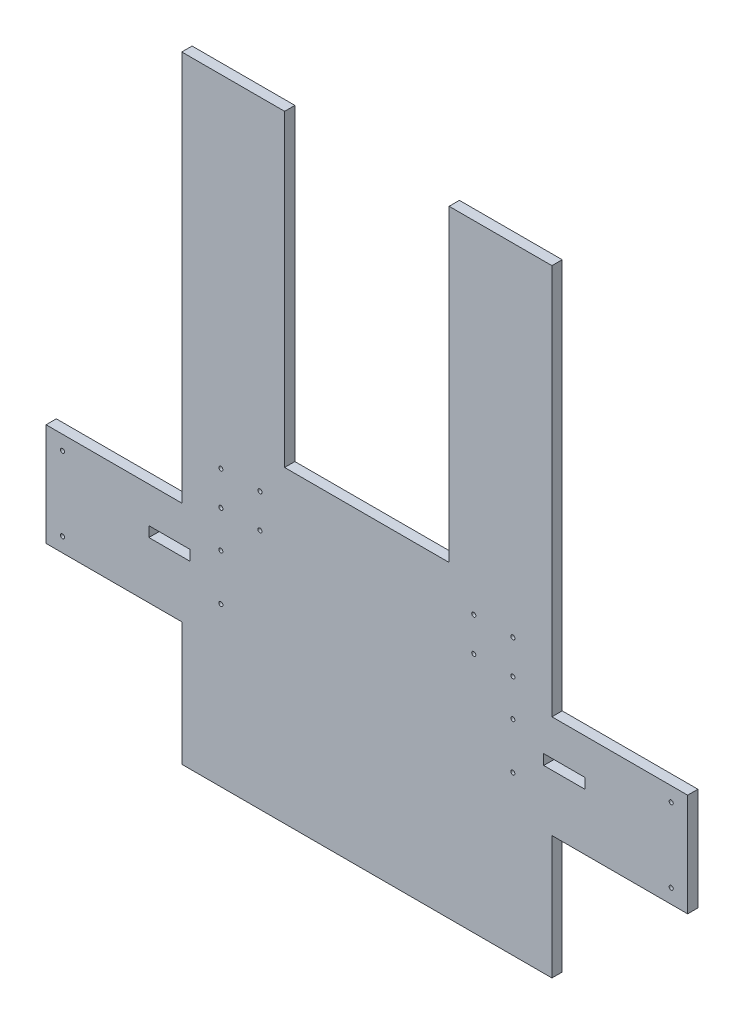
from build123d import *

# Parameters (mm, degrees)
SKETCH1_R           = 1
BOSS_EXTRUDE1_DEPTH = 5
SKETCH2_R           = 1
CUT_EXTRUDE1_DEPTH  = 388.996134001
SKETCH3_R           = 1
SKETCH3_W           = 20
SKETCH3_H           = 5
CUT_EXTRUDE2_DEPTH  = 388.996134001


with BuildPart() as part:
    # Sketch1 → Boss-Extrude1 (new body)
    with BuildSketch(Plane.XY):
        Polygon((0, 60), (0, 0), (180, 0), (180, 60), (246, 60), (246, 110), (180, 110), (180, 300), (130, 300), (130, 150), (50, 150), (50, 300), (0, 300), (0, 110), (-66, 110), (-66, 60), align=None)
        with Locations((19, 117.5)):
            Circle(SKETCH1_R, mode=Mode.SUBTRACT)
        with Locations((38, 117.5)):
            Circle(SKETCH1_R, mode=Mode.SUBTRACT)
        with Locations((19, 134)):
            Circle(SKETCH1_R, mode=Mode.SUBTRACT)
        with Locations((38, 134)):
            Circle(SKETCH1_R, mode=Mode.SUBTRACT)
        with Locations((142, 117.5)):
            Circle(SKETCH1_R, mode=Mode.SUBTRACT)
        with Locations((161, 117.5)):
            Circle(SKETCH1_R, mode=Mode.SUBTRACT)
        with Locations((142, 134)):
            Circle(SKETCH1_R, mode=Mode.SUBTRACT)
        with Locations((161, 134)):
            Circle(SKETCH1_R, mode=Mode.SUBTRACT)
    extrude(amount=BOSS_EXTRUDE1_DEPTH)

    # Sketch2 → Cut-Extrude1 (cut, through all)
    with BuildSketch(Plane.XY.offset(5)):
        with Locations((-58, 103)):
            Circle(SKETCH2_R)
        with Locations((-58, 67)):
            Circle(SKETCH2_R)
        with Locations((238, 67)):
            Circle(SKETCH2_R)
        with Locations((238, 103)):
            Circle(SKETCH2_R)
    extrude(amount=-CUT_EXTRUDE1_DEPTH, mode=Mode.SUBTRACT)

    # Sketch3 → Cut-Extrude2 (cut, through all)
    with BuildSketch(Plane.XY.offset(5)):
        with Locations((19, 77)):
            Circle(SKETCH3_R)
        with Locations((19, 99.5)):
            Circle(SKETCH3_R)
        with Locations((161, 77)):
            Circle(SKETCH3_R)
        with Locations((161, 99.5)):
            Circle(SKETCH3_R)
        with Locations((-6, 90)):
            Rectangle(SKETCH3_W, SKETCH3_H)
        with Locations((186, 90)):
            Rectangle(SKETCH3_W, SKETCH3_H)
    extrude(amount=-CUT_EXTRUDE2_DEPTH, mode=Mode.SUBTRACT)


solid = part.part
